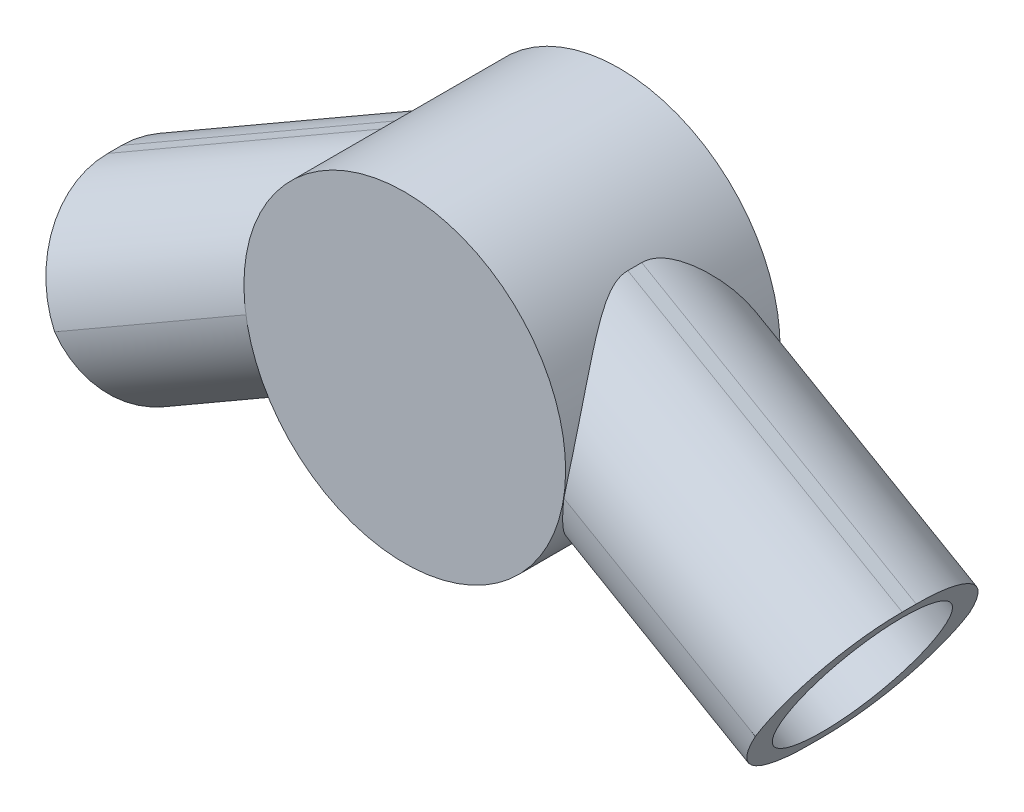
from build123d import *

# Parameters (mm, degrees)
BOSS_EXTRUDE1_DEPTH = 40
SKETCH2_R           = 15.049999999999999
CUT_EXTRUDE1_DEPTH  = 40
FILLET3_R           = 18.700000000000003
FILLET4_R           = 18.7
FILLET5_R           = 18.7
FILLET6_R           = 18.7
SKETCH4_R           = 15.049999999999999
CUT_EXTRUDE2_DEPTH  = 30


with BuildPart() as part:
    # Sketch1 → Boss-Extrude1 (new body)
    with BuildSketch(Plane.XY):
        with BuildLine():
            Line((-21.97749224689504, -20.420328952729147), (-56.618508398272695, -40.420328952728944))
            Line((-56.618508398272695, -40.420328952728944), (-74.08417498363409, -10.168907038824594))
            Line((-74.08417498363409, -10.168907038824594), (-22.896447841875652, 19.38434100567434))
            ThreePointArc((-22.896447841875652, 19.38434100567434), (1.84e-15, 30), (22.89644784187566, 19.384341005674337))
            Line((22.89644784187566, 19.384341005674337), (74.08417498363407, -10.168907038825086))
            Line((74.08417498363407, -10.168907038825086), (56.61850839827255, -40.42032895272918))
            Line((56.61850839827255, -40.42032895272918), (21.97749224689504, -20.42032895272915))
            ThreePointArc((21.97749224689504, -20.42032895272915), (-4.82e-15, -29.999999999999996), (-21.97749224689504, -20.420328952729147))
        make_face()
    extrude(amount=BOSS_EXTRUDE1_DEPTH)

    # Sketch2 → Cut-Extrude1 (cut)
    with BuildSketch(Plane(origin=(59.96639714989796, -34.62161553682567, 0), x_dir=(0, 0, -1), z_dir=(0.8660254037844382, -0.5000000000000009, 0))):
        with Locations(Location((-20, 10.769889082110701, 0), (0, 0, 90))):
            Circle(SKETCH2_R)
    cut_extrude1 = extrude(amount=-CUT_EXTRUDE1_DEPTH, mode=Mode.SUBTRACT)

    # Mirror1: Cut-Extrude1 across plane
    add(cut_extrude1.mirror(Plane(origin=(0, 0, 0), x_dir=(0, 0, 1), z_dir=(1, 0, 0))), mode=Mode.SUBTRACT)

    # Fillet3
    fillet3_edges = [part.edges().sort_by_distance(p)[0] for p in [
        (39.298000322583796, -30.420328952729164, 40),
    ]]
    fillet(fillet3_edges, radius=FILLET3_R)

    # Fillet4
    # the kernel refuses this fillet: 18.7 mm, written as the material it takes off along each edge
    with BuildSketch(Plane(origin=(-17.590239785046823, 42.759341005674386, 40), x_dir=(0, 0, -1), z_dir=(0.866025403784438, -0.5000000000000011, 0))) as fillet4_piece_1_section:
        with BuildLine():
            CenterArc((FILLET4_R, -FILLET4_R), FILLET4_R, 90, 89.99999999999997)
            Line((0, -FILLET4_R), (0, 0))
            Line((0, 0), (FILLET4_R, 0))
        make_face()
    fillet4_piece_1 = extrude(amount=152.6064960889987, mode=Mode.PRIVATE)
    fillet4_piece_1 = fillet4_piece_1 - Plane(origin=(2.66e-15, 5.33e-15, 35.12262503865641), x_dir=(-0.7632149280625219, 0.6461447001891446, 0), z_dir=(0, 0, -1)) * Cylinder(29.999999999999996, 381, mode=Mode.PRIVATE)
    add(fillet4_piece_1, mode=Mode.SUBTRACT)
    with BuildSketch(Plane(origin=(18.509195380027606, 2.9546710472706206, 0), x_dir=(-0.49999999999999495, 0.8660254037844416, 0), z_dir=(-0.8660254037844416, -0.499999999999995, 0))) as fillet4_piece_2_section:
        with BuildLine():
            CenterArc((FILLET4_R, -FILLET4_R), FILLET4_R, 90, 90)
            Line((-2.49e-15, -FILLET4_R), (0, 0))
            Line((0, 0), (FILLET4_R, 0))
        make_face()
    fillet4_piece_2 = extrude(amount=133.50000000000003, mode=Mode.PRIVATE)
    fillet4_piece_2 = fillet4_piece_2 - Plane(origin=(8.9e-16, 5.33e-15, 4.238028125601217), x_dir=(0.7325830748965012, -0.6806776317576385, 0), z_dir=(0, 0, -1)) * Cylinder(30, 342, mode=Mode.PRIVATE)
    add(fillet4_piece_2, mode=Mode.SUBTRACT)
    with BuildSketch(Plane(origin=(97.10519602519503, -63.795328952729214, 0), x_dir=(0.5000000000000009, 0.8660254037844382, 0), z_dir=(-0.8660254037844382, 0.5000000000000009, 0))) as fillet4_piece_3_section:
        with BuildLine():
            CenterArc((FILLET4_R, -FILLET4_R), FILLET4_R, 90, 90)
            Line((0, -FILLET4_R), (0, 0))
            Line((0, 0), (FILLET4_R, 0))
        make_face()
    fillet4_piece_3 = extrude(amount=133.49999999999997, mode=Mode.PRIVATE)
    fillet4_piece_3 = fillet4_piece_3 - Plane(origin=(8.9e-16, 5.33e-15, 4.238027498797153), x_dir=(0.7325830748965012, -0.6806776317576385, 0), z_dir=(0, 0, -1)) * Cylinder(30, 342, mode=Mode.PRIVATE)
    add(fillet4_piece_3, mode=Mode.SUBTRACT)

    # Fillet5
    # the kernel refuses this fillet: 18.7 mm, written as the material it takes off along each edge
    with BuildSketch(Plane(origin=(-114.57086261055673, -33.54390703882436, 0), x_dir=(0.4999999999999949, -0.8660254037844416, 0), z_dir=(0.8660254037844416, 0.49999999999999484, 0))) as fillet5_piece_1_section:
        with BuildLine():
            CenterArc((FILLET5_R, -FILLET5_R), FILLET5_R, 90, 90)
            Line((0, -FILLET5_R), (0, 0))
            Line((0, 0), (FILLET5_R, 0))
        make_face()
    fillet5_piece_1 = extrude(amount=152.6064960889985, mode=Mode.PRIVATE)
    fillet5_piece_1 = fillet5_piece_1 - Plane(origin=(8.9e-16, 5.33e-15, 4.361975698368192), x_dir=(0.7325830748965012, -0.6806776317576385, 0), z_dir=(0, 0, -1)) * Cylinder(30, 381, mode=Mode.PRIVATE)
    with BuildSketch(Plane(origin=(18.509195380027606, 2.954671047270619, 40), x_dir=(1e-17, -2e-17, -1), z_dir=(-0.8660254037844416, -0.499999999999995, 0))) as fillet5_piece_2_section:
        with BuildLine():
            CenterArc((FILLET5_R, -FILLET5_R), FILLET5_R, 90, 90)
            Line((-4.8e-16, -FILLET5_R), (0, 0))
            Line((0, 0), (FILLET5_R, 0))
        make_face()
    fillet5_piece_2 = extrude(amount=133.50000000000003, mode=Mode.PRIVATE)
    fillet5_piece_2 = fillet5_piece_2 - Plane(origin=(8.9e-16, 5.33e-15, 35.76197179193409), x_dir=(0.7325830748965012, -0.6806776317576385, 0), z_dir=(0, 0, -1)) * Cylinder(30, 342, mode=Mode.PRIVATE)
    with BuildSketch(Plane(origin=(-17.590239785046823, 42.759341005674386, 0), x_dir=(0, 0, 1), z_dir=(0.866025403784438, -0.5000000000000011, 0))) as fillet5_piece_3_section:
        with BuildLine():
            CenterArc((FILLET5_R, FILLET5_R), FILLET5_R, 180.00000000000003, 90)
            Line((-3.55e-15, FILLET5_R), (0, 0))
            Line((0, 0), (FILLET5_R, 0))
        make_face()
    fillet5_piece_3 = extrude(amount=152.6064960889987, mode=Mode.PRIVATE)
    fillet5_piece_3 = fillet5_piece_3 - Plane(origin=(8.9e-16, 5.33e-15, 4.877369917658315), x_dir=(0.7325830748965012, -0.6806776317576385, 0), z_dir=(0, 0, -1)) * Cylinder(30, 381, mode=Mode.PRIVATE)
    add([fillet5_piece_1, fillet5_piece_2, fillet5_piece_3], mode=Mode.SUBTRACT)

    # Fillet6
    # the kernel refuses this fillet: 18.7 mm, written as the material it takes off along each edge
    with BuildSketch(Plane(origin=(-114.57086261055673, -33.54390703882436, 40), x_dir=(0.4999999999999949, -0.8660254037844416, 0), z_dir=(0.8660254037844416, 0.49999999999999484, 0))) as fillet6_piece_1_section:
        with BuildLine():
            CenterArc((FILLET6_R, FILLET6_R), FILLET6_R, 180, 90)
            Line((0, FILLET6_R), (0, 0))
            Line((0, 0), (FILLET6_R, 0))
        make_face()
    fillet6_piece_1 = extrude(amount=152.6064960889985, mode=Mode.PRIVATE)
    fillet6_piece_1 = fillet6_piece_1 - Plane(origin=(8.9e-16, 5.33e-15, 35.63802430163197), x_dir=(0.7325830748965012, -0.6806776317576385, 0), z_dir=(0, 0, -1)) * Cylinder(30, 381, mode=Mode.PRIVATE)
    add(fillet6_piece_1, mode=Mode.SUBTRACT)

    # Sketch4 → Cut-Extrude2 (cut)
    with BuildSketch(Plane(origin=(0, 0, 0), x_dir=(-1, 0, 0), z_dir=(0, 0, -1))):
        Circle(SKETCH4_R)
    extrude(amount=-CUT_EXTRUDE2_DEPTH, mode=Mode.SUBTRACT)


solid = part.part
